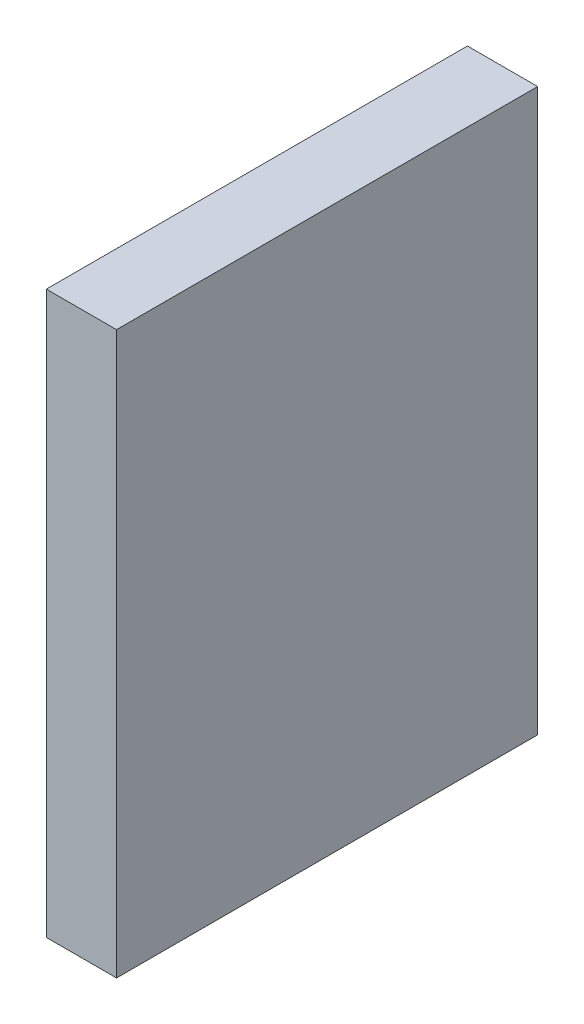
from build123d import *

# Parameters (mm, degrees)
SKETCH1_W           = 6.35
SKETCH1_H           = 50.8
BOSS_EXTRUDE1_DEPTH = 38.1


with BuildPart() as part:
    # Sketch1 → Boss-Extrude1 (new body)
    with BuildSketch(Plane.XY):
        with Locations((3.175, 25.4)):
            Rectangle(SKETCH1_W, SKETCH1_H)
    extrude(amount=BOSS_EXTRUDE1_DEPTH)


solid = part.part
